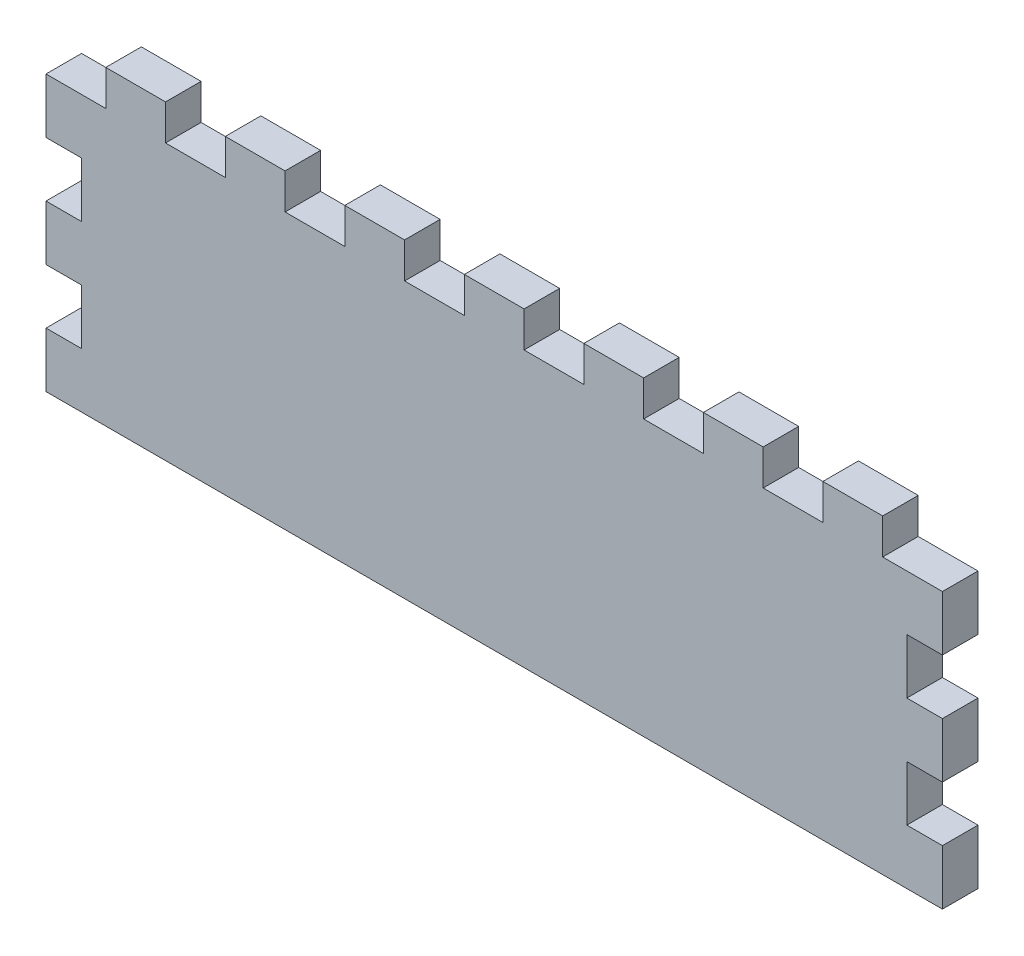
from build123d import *

# Parameters (mm, degrees)
SKETCH1_W           = 80
SKETCH1_H           = 80
BOSS_EXTRUDE1_DEPTH = 3.175
SKETCH2_OUTSIDE_W   = 104.636
SKETCH2_OUTSIDE_H   = 104.636
CUT_EXTRUDE1_DEPTH  = 57.657573413
SKETCH3_W           = 80
SKETCH3_H           = 52.275
CUT_EXTRUDE2_DEPTH  = 57.657573413


with BuildPart() as part:
    # Sketch1 → Boss-Extrude1 (new body)
    with BuildSketch(Plane.XY):
        Rectangle(SKETCH1_W, SKETCH1_H)
    extrude(amount=BOSS_EXTRUDE1_DEPTH)

    # Sketch2 outside → Cut-Extrude1 (cut, through all)
    with BuildSketch(Plane.XY.offset(3.175)):
        Rectangle(SKETCH2_OUTSIDE_W, SKETCH2_OUTSIDE_H)
        Polygon((-40, -31.915), (-40, -36.825), (-34.666666667, -36.825), (-34.666666667, -40), (-29.333333333, -40), (-29.333333333, -36.825), (-24, -36.825), (-24, -40), (-18.666666667, -40), (-18.666666667, -36.825), (-13.333333333, -36.825), (-13.333333333, -40), (-8, -40), (-8, -36.825), (-2.666666667, -36.825), (-2.666666667, -40), (2.666666667, -40), (2.666666667, -36.825), (8, -36.825), (8, -40), (13.333333333, -40), (13.333333333, -36.825), (18.666666667, -36.825), (18.666666667, -40), (24, -40), (24, -36.825), (29.333333333, -36.825), (29.333333333, -40), (34.666666667, -40), (34.666666667, -36.825), (40, -36.825), (40, -31.915), (36.825, -31.915), (36.825, -27.005), (40, -27.005), (40, -22.095), (36.825, -22.095), (36.825, -17.185), (40, -17.185), (40, -12.275), (36.825, -12.275), (36.825, -7.365), (40, -7.365), (40, -2.455), (36.825, -2.455), (36.825, 2.455), (40, 2.455), (40, 7.365), (36.825, 7.365), (36.825, 12.275), (40, 12.275), (40, 17.185), (36.825, 17.185), (36.825, 22.095), (40, 22.095), (40, 27.005), (36.825, 27.005), (36.825, 31.915), (40, 31.915), (40, 36.825), (34.666666667, 36.825), (34.666666667, 40), (29.333333333, 40), (29.333333333, 36.825), (24, 36.825), (24, 40), (18.666666667, 40), (18.666666667, 36.825), (13.333333333, 36.825), (13.333333333, 40), (8, 40), (8, 36.825), (2.666666667, 36.825), (2.666666667, 40), (-2.666666667, 40), (-2.666666667, 36.825), (-8, 36.825), (-8, 40), (-13.333333333, 40), (-13.333333333, 36.825), (-18.666666667, 36.825), (-18.666666667, 40), (-24, 40), (-24, 36.825), (-29.333333333, 36.825), (-29.333333333, 40), (-34.666666667, 40), (-34.666666667, 36.825), (-40, 36.825), (-40, 31.915), (-36.825, 31.915), (-36.825, 27.005), (-40, 27.005), (-40, 22.095), (-36.825, 22.095), (-36.825, 17.185), (-40, 17.185), (-40, 12.275), (-36.825, 12.275), (-36.825, 7.365), (-40, 7.365), (-40, 2.455), (-36.825, 2.455), (-36.825, -2.455), (-40, -2.455), (-40, -7.365), (-36.825, -7.365), (-36.825, -12.275), (-40, -12.275), (-40, -17.185), (-36.825, -17.185), (-36.825, -22.095), (-40, -22.095), (-40, -27.005), (-36.825, -27.005), (-36.825, -31.915), align=None, mode=Mode.SUBTRACT)
    extrude(amount=-CUT_EXTRUDE1_DEPTH, mode=Mode.SUBTRACT)

    # Sketch3 → Cut-Extrude2 (cut, through all)
    with BuildSketch(Plane(origin=(0, 0, 0), x_dir=(-1, 0, 0), z_dir=(0, 0, -1))):
        with Locations((0, -13.8625)):
            Rectangle(SKETCH3_W, SKETCH3_H)
    extrude(amount=-CUT_EXTRUDE2_DEPTH, mode=Mode.SUBTRACT)


solid = part.part
